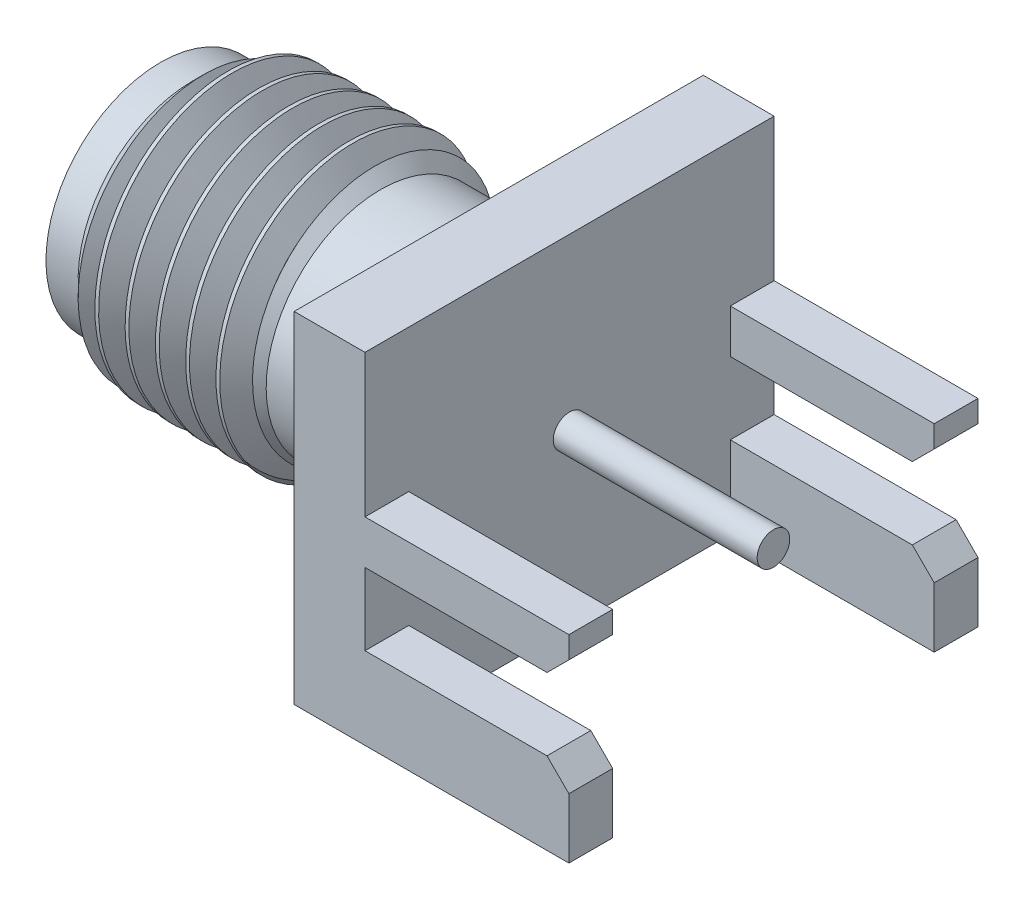
from build123d import *

# Parameters (mm, degrees)
BOSS_EXTRUDE1_DEPTH = 4.765
CUT_EXTRUDE1_START  = 2.7
SKETCH2_W           = 4.75
SKETCH2_H           = 7.49
CUT_EXTRUDE1_DEPTH  = 12.728185034
CUT_SWEEP1_PITCH    = 0.7055


with BuildPart() as part:
    # Sketch1 → Boss-Extrude1 (new, symmetric)
    with BuildSketch(Plane.XY):
        Polygon((0, 0), (0, 1.68), (4.24, 1.68), (4.75, 2.19), (4.75, 2.7), (0, 2.7), (0, 6.02), (-1.65, 6.02), (-1.65, -1.91), (4.75, -1.91), (4.75, -0.51), (4.24, 0), align=None)
    extrude(amount=BOSS_EXTRUDE1_DEPTH, both=True)

    # Sketch2 → Cut-Extrude1 (cut, through all)
    with BuildSketch(Plane(origin=(0, 0, 0), x_dir=(1, 0, 0), z_dir=(0, 1, 0)).offset(CUT_EXTRUDE1_START)):
        with Locations((2.375, 0)):
            Rectangle(SKETCH2_W, SKETCH2_H)
    extrude(amount=-CUT_EXTRUDE1_DEPTH, mode=Mode.SUBTRACT)

    # Sketch3 → Revolve1 (revolve)
    with BuildSketch(Plane.XY, mode=Mode.PRIVATE) as revolve1_sk:
        Polygon((4.75, 2.055), (4.75, 1.675), (-1.65, 1.675), (-1.65, -0.612), (-4.4, -0.612), (-4.908, -1.12), (-8.272, -1.12), (-8.78, -0.612), (-9.53, -0.612), (-9.53, -0.265), (-7.6, -0.265), (-7.6, 2.055), align=None)
    revolve(revolve1_sk.sketch.rotate(Axis((4.75, 2.055, 0), (-1, 0, 0)), 180), axis=Axis((4.75, 2.055, 0), (-1, 0, 0)))

    # Cut-Sweep1: arcs per turn and ends read off the stored shape
    # Cut-Sweep1: the profile of Sketch4 profile screwed along a right-hand helix through 10 turns, 6 arcs to a turn; built about Z, then put on its axis
    cut_sweep1_z = Axis((0, 0, 0), (0, 0, 1))
    cut_sweep1_corners = [(3.175, 0, -0.027565877), (2.6667, 0, 0.265901265), (2.6667, 0, 0.296466982), (3.175, 0, 0.589934123)]
    with BuildLine(mode=Mode.PRIVATE) as cut_sweep1_profile:
        Line(cut_sweep1_corners[0], cut_sweep1_corners[1])
        Line(cut_sweep1_corners[1], cut_sweep1_corners[2])
        Line(cut_sweep1_corners[2], cut_sweep1_corners[3])
        Line(cut_sweep1_corners[3], cut_sweep1_corners[0])
    cut_sweep1_cap = Face(cut_sweep1_profile.wire())
    cut_sweep1_turn_angles = [0, 30, 60, 90, 120, 150, 180, 210, 240, 270, 300, 330, 360]
    cut_sweep1_turn_weights = [1, 0.8660254037844387, 1, 0.8660254037844387, 1, 0.8660254037844387, 1, 0.8660254037844387, 1, 0.8660254037844387, 1, 0.8660254037844387, 1]
    cut_sweep1_turn_rails = [Edge.make_bspline([Vector(p[0], p[1], 0).rotate(cut_sweep1_z, cut_sweep1_turn_angles[k]) / cut_sweep1_turn_weights[k] + Vector(0, 0, p[2] + CUT_SWEEP1_PITCH * cut_sweep1_turn_angles[k] / 360) for k in range(13)], [0, 0, 0, 1, 1, 2, 2, 3, 3, 4, 4, 5, 5, 6, 6, 6], 2, cut_sweep1_turn_weights) for p in cut_sweep1_corners]
    cut_sweep1_turn_sides = [Face.make_surface_from_curves(cut_sweep1_turn_rails[p[0]], cut_sweep1_turn_rails[p[1]]) for p in [(0, 1), (1, 2), (2, 3), (3, 0)]]
    cut_sweep1 = Plane(origin=(-9.53, 2.055, 0), x_dir=(0, 0, -1), z_dir=(1, 0, 0)) * Solid(Shell([*[p.moved(Location((0, 0, CUT_SWEEP1_PITCH * i))) for i in range(10) for p in cut_sweep1_turn_sides], cut_sweep1_cap, cut_sweep1_cap.rotate(cut_sweep1_z, 3600).moved(Location((0, 0, CUT_SWEEP1_PITCH * 3600 / 360)))]))
    add(cut_sweep1, mode=Mode.SUBTRACT)


solid = part.part
